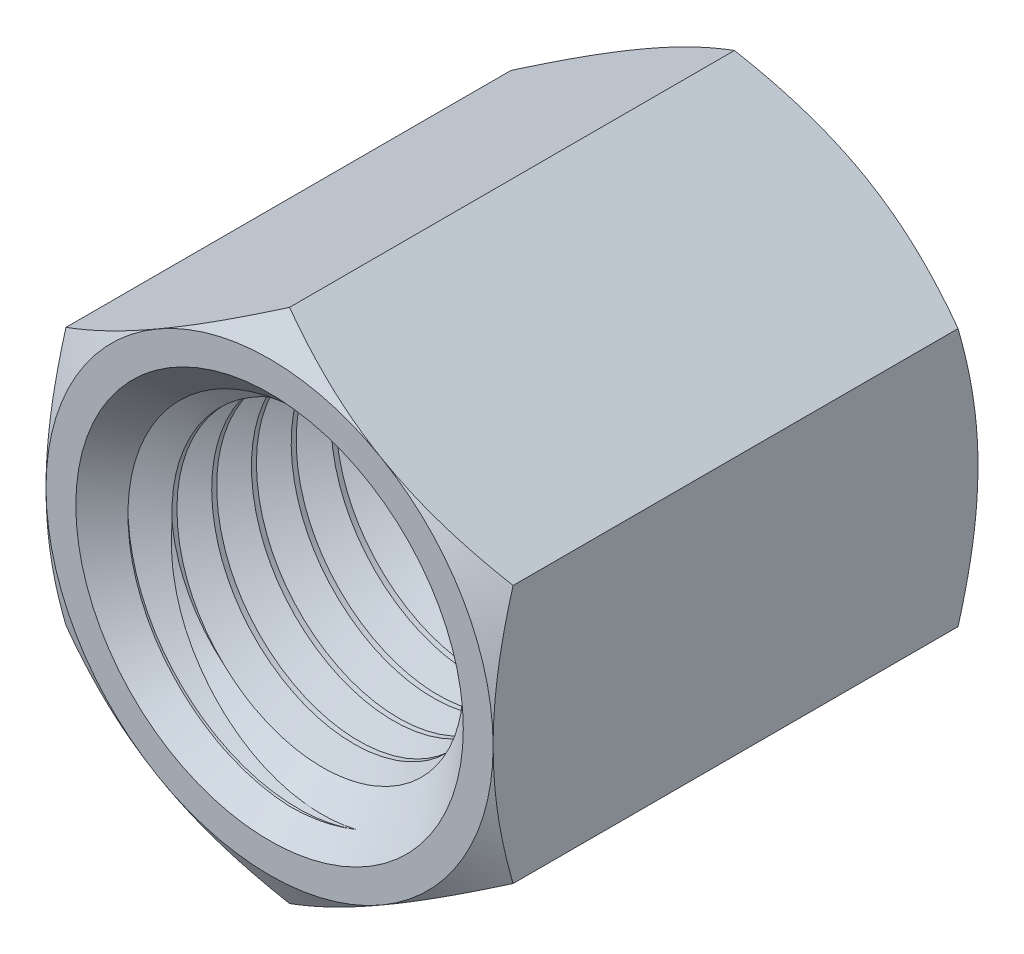
from build123d import *

# Parameters (mm, degrees)
BOSS_EXTRUDE1_DEPTH      = 7.747
BOSS_EXTRUDE1_DEPTH_BACK = 7.747
SKETCH2_R                = 3.937
SKETCH4_OUTSIDE_W        = 30.44
SKETCH4_OUTSIDE_H        = 32.65
SKETCH4_OUTSIDE_R        = 7.14375
CUT_EXTRUDE1_DEPTH       = 2.54
CUT_EXTRUDE1_DRAFT       = -60
MIRROR1_COPY_1_SKETCH_W  = 30.44
MIRROR1_COPY_1_SKETCH_H  = 32.65
MIRROR1_COPY_1_SKETCH_R  = 7.14375
MIRROR1_COPY_1_DEPTH     = 2.54
MIRROR1_COPY_1_DRAFT     = -60
SKETCH7_R                = 6.19125
BOSS_EXTRUDE2_DEPTH      = 11.938
SKETCH8_R                = 5.55625
BOSS_EXTRUDE3_DEPTH      = 11.938
CUT_SWEEP1_PITCH         = 1.27


with BuildPart() as part:
    # Sketch2 → Boss-Extrude1 (new, two sides: drawn at the far end of the back side and taken through both)
    with BuildSketch(Plane.XY.offset(-BOSS_EXTRUDE1_DEPTH_BACK)):
        Polygon((0, 8.248891971), (-7.14375, 4.124445986), (-7.14375, -4.124445986), (0, -8.248891971), (7.14375, -4.124445986), (7.14375, 4.124445986), align=None)
        Circle(SKETCH2_R, mode=Mode.SUBTRACT)
    extrude(amount=BOSS_EXTRUDE1_DEPTH + BOSS_EXTRUDE1_DEPTH_BACK)

    # Sketch3 → Cut-Revolve1 (revolve, cut)
    with BuildSketch(Plane(origin=(0, 0, 0), x_dir=(0, 0, -1), z_dir=(1, 0, 0)), mode=Mode.PRIVATE) as cut_revolve1_sk:
        Polygon((-7.747, 5.55625), (4.191, 5.55625), (4.191, 3.937), (7.747, 3.937), (7.747, 0), (-7.747, 0), align=None)
    revolve(cut_revolve1_sk.sketch.rotate(Axis((0, 0, 7.747), (0, 0, -1)), 180), axis=Axis((0, 0, 7.747), (0, 0, -1)), mode=Mode.SUBTRACT)


with BuildPart() as cut_extrude1_tool:
    # Sketch4 outside → Cut-Extrude1 (with draft: the straight prism first)
    with BuildSketch(Plane.XY.offset(7.747)):
        Rectangle(SKETCH4_OUTSIDE_W, SKETCH4_OUTSIDE_H)
        Circle(SKETCH4_OUTSIDE_R, mode=Mode.SUBTRACT)
    extrude(amount=-CUT_EXTRUDE1_DEPTH)
    # Cut-Extrude1: the draft: its side faces are tilted about the plane it starts from
    cut_extrude1_sides = [cut_extrude1_tool.faces().sort_by_distance(p)[0] for p in [
        (0, -16.325, 6.477),
        (15.22, 0, 6.477),
        (0, 16.325, 6.477),
        (-15.22, 0, 6.477),
        (-7.14375, 0, 6.477),
    ]]
    draft(cut_extrude1_sides, Plane.XY.offset(7.747), CUT_EXTRUDE1_DRAFT)


with BuildPart() as part_1:
    add(part.part)

    # Cut-Extrude1: cut by cut_extrude1_tool
    add(cut_extrude1_tool.part, mode=Mode.SUBTRACT)


with BuildPart() as mirror1_copy_1_tool:
    # Mirror1 copy 1 sketch → Mirror1 copy 1 (with draft: the straight prism first)
    with BuildSketch(Plane(origin=(0, 0, -7.747), x_dir=(1, 0, 0), z_dir=(0, 0, -1))):
        Rectangle(MIRROR1_COPY_1_SKETCH_W, MIRROR1_COPY_1_SKETCH_H)
        Circle(MIRROR1_COPY_1_SKETCH_R, mode=Mode.SUBTRACT)
    extrude(amount=-MIRROR1_COPY_1_DEPTH)
    # Mirror1 copy 1: the draft: its side faces are tilted about the plane it starts from
    mirror1_copy_1_sides = [mirror1_copy_1_tool.faces().sort_by_distance(p)[0] for p in [
        (0, -16.325, -6.477),
        (15.22, 0, -6.477),
        (0, 16.325, -6.477),
        (-15.22, 0, -6.477),
        (-7.14375, 0, -6.477),
    ]]
    draft(mirror1_copy_1_sides, Plane(origin=(0, 0, -7.747), x_dir=(1, 0, 0), z_dir=(0, 0, -1)), MIRROR1_COPY_1_DRAFT)


with BuildPart() as part_2:
    add(part_1.part)

    # Mirror1 copy 1: cut by mirror1_copy_1_tool
    add(mirror1_copy_1_tool.part, mode=Mode.SUBTRACT)

    # Cut-Extrude2 cone 1 section (through the dimple's axis) → Cut-Extrude2 (revolve, cut)
    with BuildSketch(Plane(origin=(0, 0, 7.747), x_dir=(0, -1, 0), z_dir=(1, 0, 0))):
        Polygon((0, 0), (6.19125, 0), (0, 6.19125), align=None)
    revolve(axis=Axis((0, 0, 7.747), (0, 0, -1)), mode=Mode.SUBTRACT)

    # Sketch7 → Boss-Extrude2 (add)
    with BuildSketch(Plane.XY.offset(7.747)):
        Circle(SKETCH7_R)
    extrude(amount=-BOSS_EXTRUDE2_DEPTH)


with BuildPart() as body_2:
    # Sketch8 → Boss-Extrude3 (new body)
    with BuildSketch(Plane.XY.offset(7.747)):
        Circle(SKETCH8_R)
    extrude(amount=-BOSS_EXTRUDE3_DEPTH)

    # Cut-Sweep1: the profile of Sketch9 profile screwed along a right-hand helix of 10.4 turns, 8 arcs to a turn; built about Z, then put on its axis
    cut_sweep1_z = Axis((0, 0, 0), (0, 0, 1))
    cut_sweep1_corners = [(5.55655, 0, 0.000173205), (4.662620036, 0, -0.5159375), (4.662620036, 0, -0.6746875), (5.55655, 0, -1.190798205)]
    with BuildLine(mode=Mode.PRIVATE) as cut_sweep1_profile:
        Line(cut_sweep1_corners[0], cut_sweep1_corners[1])
        Line(cut_sweep1_corners[1], cut_sweep1_corners[2])
        Line(cut_sweep1_corners[2], cut_sweep1_corners[3])
        Line(cut_sweep1_corners[3], cut_sweep1_corners[0])
    cut_sweep1_cap = Face(cut_sweep1_profile.wire())
    cut_sweep1_turn_angles = [0, 22.5, 45, 67.5, 90, 112.5, 135, 157.5, 180, 202.5, 225, 247.5, 270, 292.5, 315, 337.5, 360]
    cut_sweep1_turn_weights = [1, 0.9238795325112867, 1, 0.9238795325112867, 1, 0.9238795325112867, 1, 0.9238795325112867, 1, 0.9238795325112867, 1, 0.9238795325112867, 1, 0.9238795325112867, 1, 0.9238795325112867, 1]
    cut_sweep1_turn_rails = [Edge.make_bspline([Vector(p[0], p[1], 0).rotate(cut_sweep1_z, cut_sweep1_turn_angles[k]) / cut_sweep1_turn_weights[k] + Vector(0, 0, p[2] + CUT_SWEEP1_PITCH * cut_sweep1_turn_angles[k] / 360) for k in range(17)], [0, 0, 0, 1, 1, 2, 2, 3, 3, 4, 4, 5, 5, 6, 6, 7, 7, 8, 8, 8], 2, cut_sweep1_turn_weights) for p in cut_sweep1_corners]
    cut_sweep1_turn_sides = [Face.make_surface_from_curves(cut_sweep1_turn_rails[p[0]], cut_sweep1_turn_rails[p[1]]) for p in [(0, 1), (1, 2), (2, 3), (3, 0)]]
    cut_sweep1_last_angles = [3600, 3622.5, 3645, 3667.5, 3690, 3712.5, 3735, 3739.5, 3744]
    cut_sweep1_last_weights = [1, 0.9238795325112867, 1, 0.9238795325112867, 1, 0.9238795325112867, 1, 0.9969173337331099, 1]
    cut_sweep1_last_rails = [Edge.make_bspline([Vector(p[0], p[1], 0).rotate(cut_sweep1_z, cut_sweep1_last_angles[k]) / cut_sweep1_last_weights[k] + Vector(0, 0, p[2] + CUT_SWEEP1_PITCH * cut_sweep1_last_angles[k] / 360) for k in range(9)], [0, 0, 0, 1, 1, 2, 2, 3, 3, 4, 4, 4], 2, cut_sweep1_last_weights) for p in cut_sweep1_corners]
    cut_sweep1_last_sides = [Face.make_surface_from_curves(cut_sweep1_last_rails[p[0]], cut_sweep1_last_rails[p[1]]) for p in [(0, 1), (1, 2), (2, 3), (3, 0)]]
    cut_sweep1 = Plane(origin=(0, 0, 7.747), x_dir=(0, 1, 0), z_dir=(0, 0, -1)) * Solid(Shell([*[p.moved(Location((0, 0, CUT_SWEEP1_PITCH * i))) for i in range(10) for p in cut_sweep1_turn_sides], *cut_sweep1_last_sides, cut_sweep1_cap, cut_sweep1_cap.rotate(cut_sweep1_z, 3744).moved(Location((0, 0, CUT_SWEEP1_PITCH * 3744 / 360)))]))
    add(cut_sweep1, mode=Mode.SUBTRACT)


with BuildPart() as part_3:
    add(part_2.part)

    # Combine1: cut body 2
    add(body_2.part, mode=Mode.SUBTRACT)

    # Cut-Extrude3 cone 1 section (through the dimple's axis) → Cut-Extrude3 (revolve, cut)
    with BuildSketch(Plane(origin=(0, 0, 7.747), x_dir=(0, -1, 0), z_dir=(1, 0, 0))):
        Polygon((0, 0), (6.19125, 0), (0, 6.19125), align=None)
    revolve(axis=Axis((0, 0, 7.747), (0, 0, -1)), mode=Mode.SUBTRACT)


solid = part_3.part
